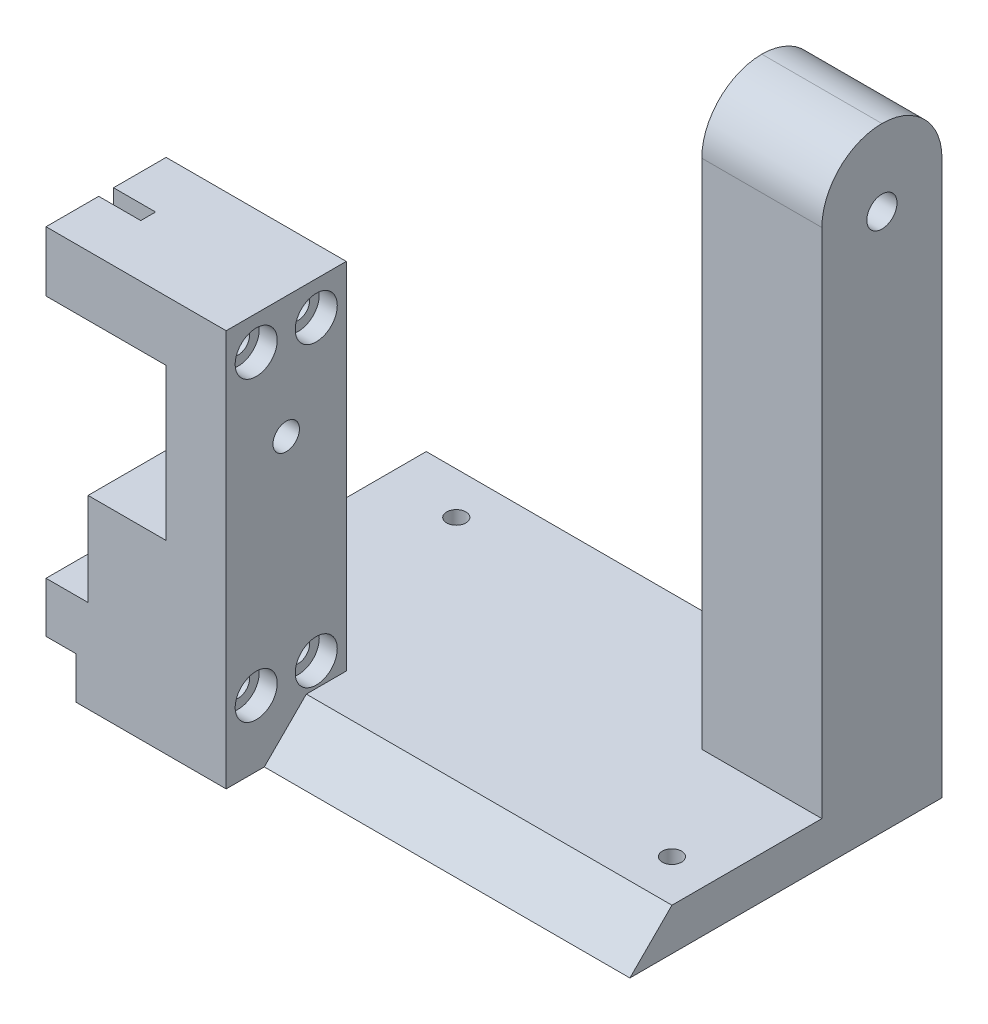
from build123d import *

# Parameters (mm, degrees)
SKETCH1_W                = 25
SKETCH1_H                = 20
BOSS_EXTRUDE1_DEPTH      = 168.81
SKETCH1_W_2              = 20
BOSS_EXTRUDE1_2_DEPTH    = 168.81
CUT_EXTRUDE1_DEPTH       = 194.087721945
CUT_EXTRUDE1_DEPTH_BACK  = 194.087721945
SKETCH2_W                = 25
SKETCH2_H                = 44.708
FILLET2_R                = 10
CUT_EXTRUDE2_DEPTH       = 196.466757701
CUT_EXTRUDE2_DEPTH_BACK  = 196.466757701
SKETCH4_R                = 2.515
CUT_EXTRUDE3_DEPTH       = 186.844513952
CUT_EXTRUDE3_DEPTH_BACK  = 186.844513952
SKETCH3_R                = 2.2
SKETCH5_W                = 58.32
SKETCH5_H                = 66.56
CUT_EXTRUDE4_DEPTH       = 84.405
BOSS_EXTRUDE2_DEPTH      = 7
CHAMFER1_SIZE            = 7
SKETCH8_W                = 20
SKETCH8_H                = 13.858822584
SKETCH8_H_2              = 30.45
CUT_EXTRUDE6_DEPTH       = 2
SKETCH9_W                = 20
SKETCH9_H                = 31.847227872
CUT_EXTRUDE7_DEPTH       = 13
BOSS_EXTRUDE3_START      = -10
SKETCH10_W               = 20
SKETCH10_H               = 10
BOSS_EXTRUDE3_DEPTH      = 30
SKETCH11_W               = 20
SKETCH11_H               = 8.385
BOSS_EXTRUDE4_DEPTH      = 5
CUT_EXTRUDE8_DEPTH       = 135.813629748
CUT_EXTRUDE8_DEPTH_BACK  = 135.813629748
SKETCH12_R               = 1.6
CUT_EXTRUDE11_DEPTH      = 198.714610907
CUT_EXTRUDE11_DEPTH_BACK = 198.714610907
SKETCH13_R               = 1.9
SKETCH14_R               = 3.5
CUT_EXTRUDE12_DEPTH      = 3
CUT_EXTRUDE13_REACH      = 199.715
SKETCH16_W               = 2.468990405
SKETCH16_H               = 10
SKETCH16_W_2             = 2.323465518
SKETCH16_H_2             = 8.385


with BuildPart() as part:
    # Sketch1 → Boss-Extrude1 (new body)
    with BuildSketch(Plane(origin=(0, 0, 0), x_dir=(1, 0, 0), z_dir=(0, 1, 0))):
        Rectangle(SKETCH1_W, SKETCH1_H)
    extrude(amount=BOSS_EXTRUDE1_DEPTH)

    # Sketch2 → Cut-Extrude1 (cut, two sides: drawn at the far end of the back side and taken through both)
    with BuildSketch(Plane.XY.offset(10).offset(-CUT_EXTRUDE1_DEPTH_BACK)):
        with Locations((0, 146.456)):
            Rectangle(SKETCH2_W, SKETCH2_H)
    extrude(amount=CUT_EXTRUDE1_DEPTH + CUT_EXTRUDE1_DEPTH_BACK, mode=Mode.SUBTRACT)

    # Sketch3 → Cut-Extrude3 (cut, two sides: drawn at the far end of the back side and taken through both)
    with BuildSketch(Plane(origin=(12.5, 0, 0), x_dir=(0, 0, -1), z_dir=(1, 0, 0)).offset(-CUT_EXTRUDE3_DEPTH_BACK)):
        with Locations((0, 112.395)):
            Circle(SKETCH3_R)
    extrude(amount=CUT_EXTRUDE3_DEPTH + CUT_EXTRUDE3_DEPTH_BACK, mode=Mode.SUBTRACT)


with BuildPart() as body_2:
    # Sketch1 → Boss-Extrude1 2 (new body)
    with BuildSketch(Plane(origin=(0, 0, 0), x_dir=(1, 0, 0), z_dir=(0, 1, 0))):
        with Locations((63.3814, 38.32)):
            Rectangle(SKETCH1_W_2, SKETCH1_H)
    extrude(amount=BOSS_EXTRUDE1_2_DEPTH)

    # Fillet2
    fillet2_edges = [body_2.edges().sort_by_distance(p)[0] for p in [
        (63.3814, 168.81, -48.32),
        (63.3814, 168.81, -28.32),
    ]]
    fillet(fillet2_edges, radius=FILLET2_R - 0.0001)  # a hair under: the kernel refuses the full size

    # Sketch4 → Cut-Extrude2 (cut, two sides: drawn at the far end of the back side and taken through both)
    with BuildSketch(Plane(origin=(73.3814, 0, 0), x_dir=(0, 0, -1), z_dir=(1, 0, 0)).offset(-CUT_EXTRUDE2_DEPTH_BACK)):
        with Locations((38.32, 156.1084)):
            Circle(SKETCH4_R)
    extrude(amount=CUT_EXTRUDE2_DEPTH + CUT_EXTRUDE2_DEPTH_BACK, mode=Mode.SUBTRACT)


with BuildPart() as cut_extrude4_tool:
    # Sketch5 → Cut-Extrude4 (new, symmetric)
    with BuildSketch(Plane(origin=(12.5, 0, 0), x_dir=(0, 0, -1), z_dir=(1, 0, 0))):
        with Locations((19.16, 33.28)):
            Rectangle(SKETCH5_W, SKETCH5_H)
    extrude(amount=CUT_EXTRUDE4_DEPTH, both=True)


with BuildPart() as part_1:
    add(part.part)

    # Cut-Extrude4: cut by cut_extrude4_tool
    add(cut_extrude4_tool.part, mode=Mode.SUBTRACT)



with BuildPart() as body_2_1:
    add(body_2.part)

    # Cut-Extrude4: cut by cut_extrude4_tool
    add(cut_extrude4_tool.part, mode=Mode.SUBTRACT)


with BuildPart() as part_2:
    add(part_1.part)

    add(body_2_1.part)  # Boss-Extrude2 merges body 2
    # Sketch6 → Boss-Extrude2 (add)
    with BuildSketch(Plane.XZ.offset(-66.56)):
        Polygon((12.5, 10), (-12.5, 10), (-12.5, -48.32), (53.3814, -48.32), (53.3814, -28.32), (73.3814, -28.32), (73.3814, 3.65), (12.5, 3.65), align=None)
    extrude(amount=-BOSS_EXTRUDE2_DEPTH)

    # Chamfer1
    chamfer1_edges = [part_2.edges().sort_by_distance(p)[0] for p in [
        (42.9407, 73.56, 3.65),
    ]]
    chamfer(chamfer1_edges, length=CHAMFER1_SIZE - 0.0001)  # a hair under: the kernel refuses the full size

    # Sketch8 → Cut-Extrude6 (cut)
    with BuildSketch(Plane.ZY.offset(12.5)):
        with Locations((0, 119.324411292)):
            Rectangle(SKETCH8_W, SKETCH8_H)
        with Locations((0, 97.17)):
            Rectangle(SKETCH8_W, SKETCH8_H_2)
    extrude(amount=-CUT_EXTRUDE6_DEPTH, mode=Mode.SUBTRACT)

    # Sketch9 → Cut-Extrude7 (cut)
    with BuildSketch(Plane.ZY.offset(10.5)):
        with Locations((0, 113.318613936)):
            Rectangle(SKETCH9_W, SKETCH9_H)
    extrude(amount=-CUT_EXTRUDE7_DEPTH, mode=Mode.SUBTRACT)

    # Sketch10 → Boss-Extrude3 (add)
    with BuildSketch(Plane.ZY.offset(-2.5).offset(BOSS_EXTRUDE3_START)):
        with Locations((0, 127.645)):
            Rectangle(SKETCH10_W, SKETCH10_H)
    extrude(amount=BOSS_EXTRUDE3_DEPTH)

    # Sketch11 → Boss-Extrude4 (add)
    with BuildSketch(Plane.ZY.offset(12.5)):
        with Locations((0, 77.7525)):
            Rectangle(SKETCH11_W, SKETCH11_H)
    extrude(amount=BOSS_EXTRUDE4_DEPTH)

    # Sketch12 → Cut-Extrude8 (cut, two sides: drawn at the far end of the back side and taken through both)
    with BuildSketch(Plane.XZ.offset(-66.56).offset(-CUT_EXTRUDE8_DEPTH_BACK)):
        with Locations(Location((-0.5, -17, 0), (0, 0, 270))):
            Circle(SKETCH12_R)
        with Locations(Location((46.3814, -41.32, 0), (0, 0, 270))):
            Circle(SKETCH12_R)
        with Locations(Location((66.3814, -10.35, 0), (0, 0, 270))):
            Circle(SKETCH12_R)
        with Locations(Location((-0.5, -41.32, 0), (0, 0, 270))):
            Circle(SKETCH12_R)
    extrude(amount=CUT_EXTRUDE8_DEPTH + CUT_EXTRUDE8_DEPTH_BACK, mode=Mode.SUBTRACT)

    # Sketch13 → Cut-Extrude11 (cut, two sides: drawn at the far end of the back side and taken through both)
    with BuildSketch(Plane.ZY.offset(17.5).offset(-CUT_EXTRUDE11_DEPTH_BACK)):
        with Locations((-5, 127.045)):
            Circle(SKETCH13_R)
        with Locations((5, 127.045)):
            Circle(SKETCH13_R)
        with Locations((5, 77.545)):
            Circle(SKETCH13_R)
        with Locations((-5, 77.545)):
            Circle(SKETCH13_R)
    extrude(amount=CUT_EXTRUDE11_DEPTH + CUT_EXTRUDE11_DEPTH_BACK, mode=Mode.SUBTRACT)

    # Sketch14 → Cut-Extrude12 (cut)
    with BuildSketch(Plane(origin=(12.5, 0, 0), x_dir=(0, 0, -1), z_dir=(1, 0, 0))):
        with Locations((5, 127.045)):
            Circle(SKETCH14_R)
        with Locations((-5, 127.045)):
            Circle(SKETCH14_R)
        with Locations((-5, 77.545)):
            Circle(SKETCH14_R)
        with Locations((5, 77.545)):
            Circle(SKETCH14_R)
    extrude(amount=-CUT_EXTRUDE12_DEPTH, mode=Mode.SUBTRACT)

    # Cut-Extrude13: up to this face of the body (flat: up to its plane)
    cut_extrude13_end = Plane(part_2.part.faces().sort_by_distance((-10.5, 89.67, 0))[0])
    # Sketch16 → Cut-Extrude13 (cut, up to the picked face)
    with BuildSketch(Plane.ZY.offset(17.5), mode=Mode.PRIVATE) as cut_extrude13_sk1:
        with Locations((-0.007149366, 127.645)):
            Rectangle(SKETCH16_W, SKETCH16_H)
    cut_extrude13_tool1 = split(extrude(cut_extrude13_sk1.sketch, amount=-CUT_EXTRUDE13_REACH, mode=Mode.PRIVATE), bisect_by=cut_extrude13_end, keep=Keep.BOTH, mode=Mode.PRIVATE)
    # Sketch16 → Cut-Extrude13 (cut, up to the picked face)
    with BuildSketch(Plane.ZY.offset(17.5), mode=Mode.PRIVATE) as cut_extrude13_sk2:
        with Locations((-0.29586588, 77.7525)):
            Rectangle(SKETCH16_W_2, SKETCH16_H_2)
    cut_extrude13_tool2 = split(extrude(cut_extrude13_sk2.sketch, amount=-CUT_EXTRUDE13_REACH, mode=Mode.PRIVATE), bisect_by=cut_extrude13_end, keep=Keep.BOTH, mode=Mode.PRIVATE)
    add(cut_extrude13_tool1.solids().sort_by(Axis((-17.5, 127.645, -0.007149), (1, 0, 0)))[0], mode=Mode.SUBTRACT)
    add(cut_extrude13_tool2.solids().sort_by(Axis((-17.5, 77.7525, -0.295866), (1, 0, 0)))[0], mode=Mode.SUBTRACT)


solid = part_2.part
